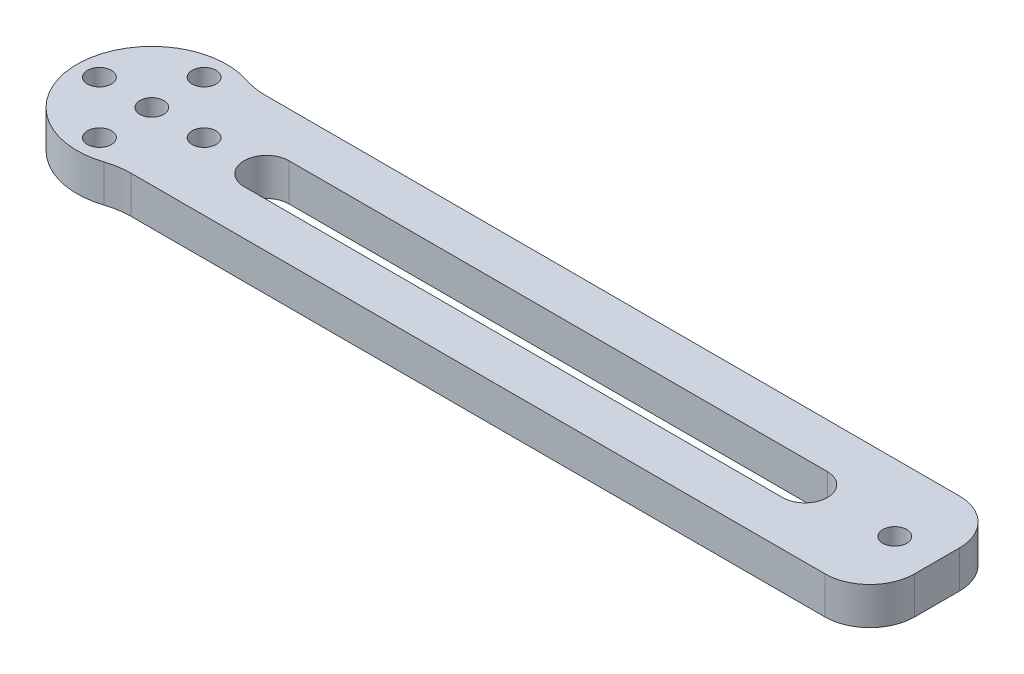
from build123d import *

# Parameters (mm, degrees)
SKETCH_1_R          = 1.6
EXTRUDE_1_DEPTH     = 5
SKETCH_2_R          = 4.2
CUT_EXTRUDE_1_DEPTH = 2.5
EXTRUDE_START       = -5
SKETCH_3_R          = 10
SKETCH_3_R_2        = 9
EXTRUDE_2_DEPTH     = 5
FILLET_1_R          = 10


with BuildPart() as part:
    # 草图1 → 凸台-拉伸1 (new body)
    with BuildSketch(Plane(origin=(0, 0, 0), x_dir=(1, 0, 0), z_dir=(0, 1, 0))):
        with BuildLine():
            Line((99, 9), (0, 9))
            ThreePointArc((0, 9), (-9, 0), (0, -9))
            Line((0, -9), (99, -9))
            ThreePointArc((99, -9), (103.242640687, -7.242640687), (105, -3))
            Line((105, -3), (105, 3))
            ThreePointArc((105, 3), (103.242640687, 7.242640687), (99, 9))
        make_face()
        with BuildLine():
            ThreePointArc((15.34, -3), (12.34, 0), (15.34, 3))
            Line((15.34, 3), (87.34, 3))
            ThreePointArc((87.34, 3), (90.34, 0), (87.34, -3))
            Line((87.34, -3), (15.34, -3))
        make_face(mode=Mode.SUBTRACT)
        with Locations((99.34, 0)):
            Circle(SKETCH_1_R, mode=Mode.SUBTRACT)
        with Locations((7, 0)):
            Circle(SKETCH_1_R, mode=Mode.SUBTRACT)
        with Locations((0, 7)):
            Circle(SKETCH_1_R, mode=Mode.SUBTRACT)
        with Locations((0, -7)):
            Circle(SKETCH_1_R, mode=Mode.SUBTRACT)
        with Locations((-7, 0)):
            Circle(SKETCH_1_R, mode=Mode.SUBTRACT)
        Circle(SKETCH_1_R, mode=Mode.SUBTRACT)
    extrude(amount=EXTRUDE_1_DEPTH)

    # 草图2 → 切除-拉伸1 (cut)
    with BuildSketch(Plane.XZ):
        with Locations((99.34, 0)):
            Circle(SKETCH_2_R)
    extrude(amount=-CUT_EXTRUDE_1_DEPTH, mode=Mode.SUBTRACT)

    # 草图3 → 凸台-拉伸2 (add)
    with BuildSketch(Plane(origin=(0, 5, 0), x_dir=(1, 0, 0), z_dir=(0, 1, 0)).offset(EXTRUDE_START)):
        Circle(SKETCH_3_R)
        Circle(SKETCH_3_R_2, mode=Mode.SUBTRACT)
    extrude(amount=EXTRUDE_2_DEPTH)

    # 圆角1
    fillet_1_edges = [part.edges().sort_by_distance(p)[0] for p in [
        (4.358898944, 2.5, 9),
        (4.358898944, 2.5, -9),
    ]]
    fillet(fillet_1_edges, radius=FILLET_1_R)


solid = part.part
